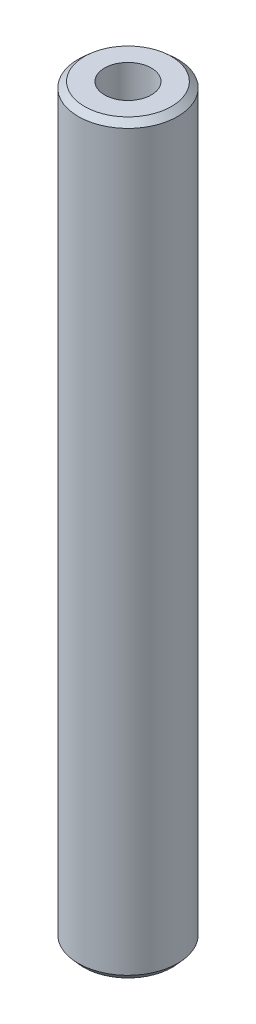
from build123d import *
from OCP.BRepFilletAPI import BRepFilletAPI_MakeChamfer

# Parameters (mm, degrees)
SKETCH1_R           = 40
BOSS_EXTRUDE1_DEPTH = 600
SKETCH2_R           = 18.808072677
CUT_EXTRUDE1_DEPTH  = 603.660766933
CHAMFER1_SIZE       = 4.459053445
CHAMFER1_SIZE2      = 5.03259082


with BuildPart() as part:
    # Sketch1 → Boss-Extrude1 (new body)
    with BuildSketch(Plane(origin=(0, 0, 0), x_dir=(1, 0, 0), z_dir=(0, 1, 0))):
        Circle(SKETCH1_R)
    extrude(amount=BOSS_EXTRUDE1_DEPTH)

    # Sketch2 → Cut-Extrude1 (cut, through all)
    with BuildSketch(Plane(origin=(0, 0, 0), x_dir=(1, 0, 0), z_dir=(0, 1, 0))):
        Circle(SKETCH2_R)
    extrude(amount=CUT_EXTRUDE1_DEPTH, mode=Mode.SUBTRACT)

    # Chamfer1: one chamfer whose edges measure the first distance from different faces: ONE call of the kernel's chamfer builder (chamfer() names one face for all edges)
    chamfer1_edges_1 = [part.edges().sort_by_distance(p)[0] for p in [
        (-40, 600, 0),
    ]]
    chamfer1_side_1 = [part.faces().sort_by_distance(p)[0] for p in [
        (-40, 300, 0),
    ]]
    chamfer1_edges_2 = [part.edges().sort_by_distance(p)[0] for p in [
        (-40, 0, 0),
    ]]
    chamfer1_side_2 = [part.faces().sort_by_distance(p)[0] for p in [
        (-38.86862915, 0, 0),
    ]]
    chamfer1 = BRepFilletAPI_MakeChamfer(part.part.solid().wrapped)
    for e in chamfer1_edges_1:
        chamfer1.Add(CHAMFER1_SIZE, CHAMFER1_SIZE2, e.wrapped, chamfer1_side_1[0].wrapped)  # the first distance lies on this face
    for e in chamfer1_edges_2:
        chamfer1.Add(CHAMFER1_SIZE, CHAMFER1_SIZE2, e.wrapped, chamfer1_side_2[0].wrapped)  # the first distance lies on this face
    add(Compound.cast(chamfer1.Shape()), mode=Mode.REPLACE)


solid = part.part
